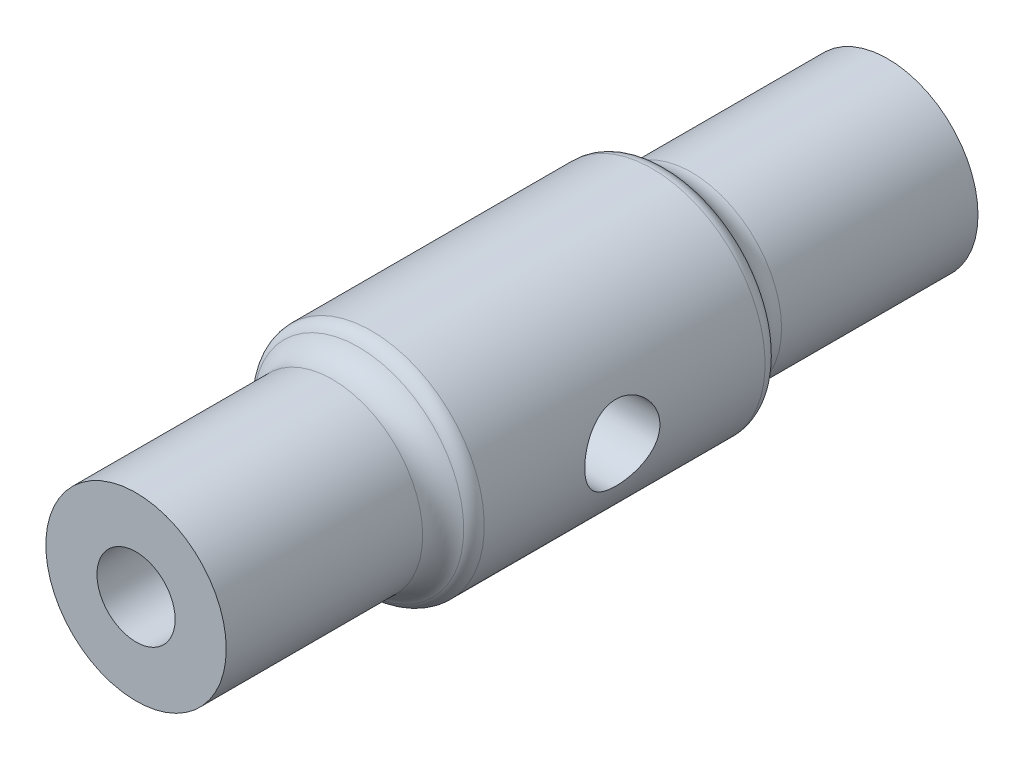
from build123d import *

# Parameters (mm, degrees)
SKETCH1_R           = 6
BOSS_EXTRUDE1_DEPTH = 7.5
SKETCH2_R           = 7.5
BOSS_EXTRUDE2_DEPTH = 20
SKETCH3_R           = 3.1
CUT_EXTRUDE1_DEPTH  = 15
SKETCH4_R           = 2.5
CUT_EXTRUDE2_DEPTH  = 11
CUT_EXTRUDE3_DEPTH  = 20
FILLET1_R           = 2
FILLET2_R           = 1
SKETCH7_R           = 2.6
CUT_EXTRUDE4_DEPTH  = 15
CUT_EXTRUDE5_START  = -6
CUT_EXTRUDE5_DEPTH  = 6


with BuildPart() as part:
    # Sketch1 → Boss-Extrude1 (new, symmetric)
    with BuildSketch(Plane.XY):
        Circle(SKETCH1_R)
    boss_extrude1 = extrude(amount=BOSS_EXTRUDE1_DEPTH, both=True)

    # Sketch2 → Boss-Extrude2 (add)
    with BuildSketch(Plane.XY.offset(7.5)):
        Circle(SKETCH2_R)
    extrude(amount=BOSS_EXTRUDE2_DEPTH)

    # Mirror1: Boss-Extrude1 across plane
    add(boss_extrude1.mirror(Plane.XY.offset(17.5)))

    # Sketch3 → Cut-Extrude1 (cut)
    with BuildSketch(Plane(origin=(0, 0, -7.5), x_dir=(-1, 0, 0), z_dir=(0, 0, -1))):
        Circle(SKETCH3_R)
    extrude(amount=-CUT_EXTRUDE1_DEPTH, mode=Mode.SUBTRACT)

    # Sketch4 → Cut-Extrude2 (cut, symmetric)
    with BuildSketch(Plane(origin=(0, 0, 0), x_dir=(0, 0, -1), z_dir=(1, 0, 0))):
        with Locations(Location((-17.655484387, 0, 0), (0, 0, 180))):
            Circle(SKETCH4_R)
    extrude(amount=CUT_EXTRUDE2_DEPTH, both=True, mode=Mode.SUBTRACT)

    # Sketch6 → Cut-Extrude3 (cut)
    with BuildSketch(Plane(origin=(0, 0, 0), x_dir=(1, 0, 0), z_dir=(0, 1, 0))):
        with BuildLine():
            Line((3, -11.5), (3, -23.5))
            ThreePointArc((3, -23.5), (0, -26.5), (-3, -23.5))
            Line((-3, -23.5), (-3, -11.5))
            ThreePointArc((-3, -11.5), (0, -8.5), (3, -11.5))
        make_face()
    extrude(amount=-CUT_EXTRUDE3_DEPTH, mode=Mode.SUBTRACT)

    # Fillet1
    # the kernel refuses this fillet: 2 mm, written as the material it adds along each edge
    with BuildSketch(Plane(origin=(0, 0, 7.5), x_dir=(1, 0, 0), z_dir=(0, -1, 0))) as fillet1_piece_1:
        with BuildLine():
            CenterArc((8, -1.936491673), FILLET1_R, 104.477512186, 75.522487814)
            Line((6, -1.936491673), (5.96, -1.936491673))
            Line((5.96, -1.936491673), (5.96, 0))
            Line((5.96, 0), (6, 0.04))
            ThreePointArc((6, 0.04), (6.75, 0.04), (7.49, 0.038729833))
            Line((7.49, 0.038729833), (7.5, 0))
        make_face()
    revolve(axis=Axis((0, 0, 7.5), (0, 0, 1)))
    with BuildSketch(Plane(origin=(0, 0, 27.5), x_dir=(1, 0, 0), z_dir=(0, -1, 0))) as fillet1_piece_2:
        with BuildLine():
            CenterArc((8, 1.936491673), FILLET1_R, 180, 75.522487814)
            Line((6, 1.936491673), (5.96, 1.936491673))
            Line((5.96, 1.936491673), (5.96, 0))
            Line((5.96, 0), (6, -0.04))
            ThreePointArc((6, -0.04), (6.75, -0.04), (7.49, -0.038729833))
            Line((7.49, -0.038729833), (7.5, 0))
        make_face()
    revolve(axis=Axis((0, 0, 27.5), (0, 0, 1)))

    # Fillet2
    fillet2_edges = [part.edges().sort_by_distance(p)[0] for p in [
        (-7.5, 0, 7.5),
        (-7.5, 0, 27.5),
    ]]
    fillet(fillet2_edges, radius=FILLET2_R)

    # Sketch7 → Cut-Extrude4 (cut)
    with BuildSketch(Plane.XY.offset(42.5)):
        Circle(SKETCH7_R)
    extrude(amount=-CUT_EXTRUDE4_DEPTH, mode=Mode.SUBTRACT)

    # Sketch8 → Cut-Extrude5 (cut)
    with BuildSketch(Plane.XZ.offset(CUT_EXTRUDE5_START)):
        with BuildLine():
            Line((3, 20.155484387), (-3, 20.155484387))
            Line((-3, 20.155484387), (-3, 15.155484387))
            Line((-3, 15.155484387), (-3, 11.5))
            ThreePointArc((-3, 11.5), (0, 8.5), (3, 11.5))
            Line((3, 11.5), (3, 15.155484387))
            Line((3, 15.155484387), (3, 20.155484387))
        make_face()
        with BuildLine():
            Line((-3, 20.155484387), (3, 20.155484387))
            Line((3, 20.155484387), (3, 23.5))
            ThreePointArc((3, 23.5), (0, 26.5), (-3, 23.5))
            Line((-3, 23.5), (-3, 20.155484387))
        make_face()
    extrude(amount=CUT_EXTRUDE5_DEPTH, mode=Mode.SUBTRACT)


solid = part.part
